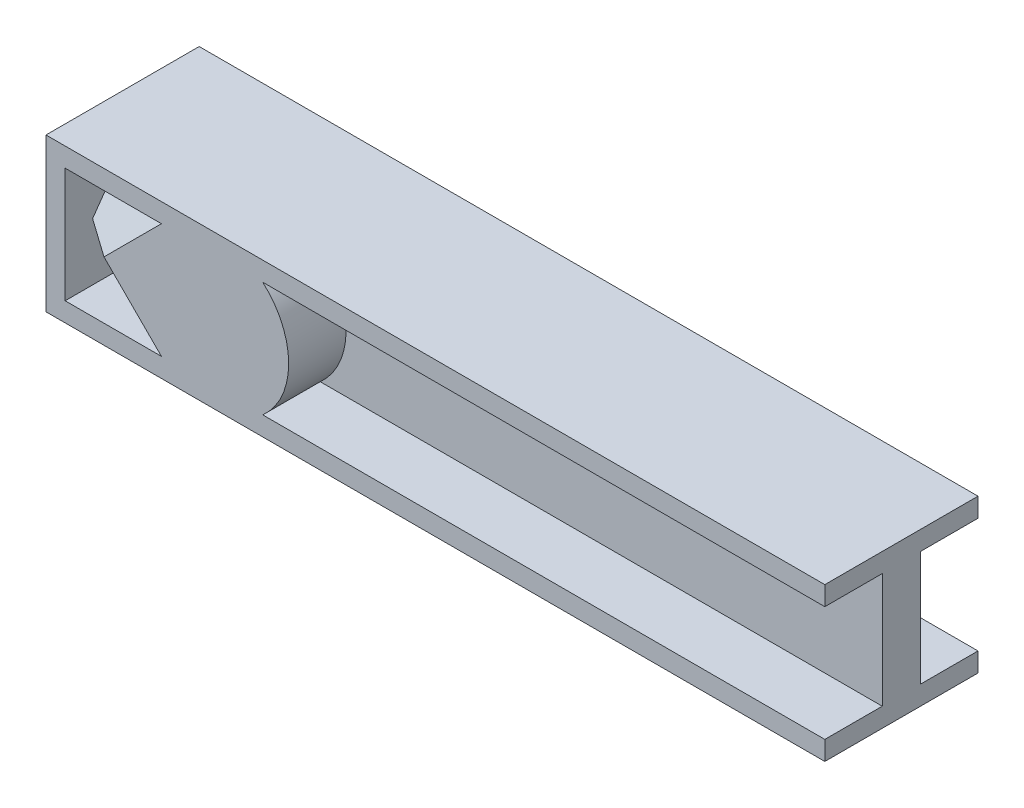
from build123d import *

# Parameters (mm, degrees)
SKETCH1_W           = 80
SKETCH1_H           = 20
BOSS_EXTRUDE1_DEPTH = 10
SKETCH2_W           = 80
SKETCH2_H           = 7.5
CUT_EXTRUDE1_DEPTH  = 7.5
BOSS_EXTRUDE2_DEPTH = 10
SKETCH4_W           = 25.799353936
SKETCH4_H           = 15
BOSS_EXTRUDE3_DEPTH = 2.5
CHAMFER1_SIZE       = 7.5


# Some blends are built 0.0001 mm under size
with BuildPart() as part:
    # Sketch1 → Boss-Extrude1 (new, symmetric)
    with BuildSketch(Plane(origin=(0, 0, 0), x_dir=(1, 0, 0), z_dir=(0, 1, 0))):
        Rectangle(SKETCH1_W, SKETCH1_H)
    extrude(amount=BOSS_EXTRUDE1_DEPTH, both=True)

    # Sketch2 → Cut-Extrude1 (cut, symmetric)
    with BuildSketch(Plane(origin=(0, 0, 0), x_dir=(1, 0, 0), z_dir=(0, 1, 0))):
        with Locations((0, 6.25)):
            Rectangle(SKETCH2_W, SKETCH2_H)
        with Locations((0, -6.25)):
            Rectangle(SKETCH2_W, SKETCH2_H)
    extrude(amount=CUT_EXTRUDE1_DEPTH, both=True, mode=Mode.SUBTRACT)

    # Sketch3 → Boss-Extrude2 (add, symmetric)
    with BuildSketch(Plane.XY):
        with BuildLine():
            Line((-40, 10), (-61.684975658, 10))
            Line((-61.684975658, 10), (-61.684975658, -10))
            Line((-61.684975658, -10), (-40, -10))
            ThreePointArc((-40, -10), (-30, 0), (-40, 10))
        make_face()
        Polygon((-46.614378278, 7.5), (-54.114378278, 0), (-46.614378278, -7.5), (-59.184975658, -7.5), (-59.184975658, 7.5), align=None, mode=Mode.SUBTRACT)
    extrude(amount=BOSS_EXTRUDE2_DEPTH, both=True)

    # Sketch4 → Boss-Extrude3 (add, symmetric)
    with BuildSketch(Plane.XY):
        with Locations((-46.28529869, 0)):
            Rectangle(SKETCH4_W, SKETCH4_H)
    extrude(amount=BOSS_EXTRUDE3_DEPTH, both=True)

    # Chamfer1
    # the kernel refuses this chamfer: 7.5 mm, written as the material it adds along each edge
    with BuildSketch(Plane(origin=(-54.114378278, 0, 2.5), x_dir=(0.019442520806014087, 0.019442520806013695, 0.9996219169112968), z_dir=(0.7071067811865405, -0.7071067811865547, 0))) as chamfer1_piece_1_section:
        with BuildLine():
            Line((7.715048964, 0), (-0.424103662, 7.703383451))
            Line((-0.424103662, 7.703383451), (-0.574046949, 7.69925907))
            ThreePointArc((-0.574046949, 7.69925907), (-0.255969203, 3.850483722), (-0.149943288, -0.004124381))
            Line((-0.149943288, -0.004124381), (0.004124381, -0.149943288))
            ThreePointArc((0.004124381, -0.149943288), (3.858732485, -0.043917372), (7.719173345, -0.149943288))
            Line((7.719173345, -0.149943288), (7.715048964, 0))
        make_face()
    chamfer1_piece_1 = extrude(amount=29.894224128, mode=Mode.PRIVATE)
    chamfer1_piece_1 = split(chamfer1_piece_1, bisect_by=Plane(origin=(-52.527454049, -4.471025257, 10), z_dir=(0, 0, -1)), keep=Keep.TOP, mode=Mode.PRIVATE)
    chamfer1_piece_1 = split(chamfer1_piece_1, bisect_by=Plane(origin=(-52.527454049, -7.5, 5.197194263), z_dir=(0, 1, 0)), keep=Keep.TOP, mode=Mode.PRIVATE)
    add(chamfer1_piece_1)
    chamfer1_2_edges = [part.edges().sort_by_distance(p)[0] for p in [
        (-52.899676968, 1.21470131, 2.5),
    ]]
    chamfer(chamfer1_2_edges, length=CHAMFER1_SIZE - 0.0001)  # a hair under: the kernel refuses the full size
    # the kernel refuses this chamfer: 7.5 mm, written as the material it adds along each edge
    with BuildSketch(Plane(origin=(-54.114378278, 0, -2.5), x_dir=(0.019442520806014087, 0.019442520806013695, -0.9996219169112968), z_dir=(0.7071067811865405, -0.7071067811865547, 0))) as chamfer1_3_piece_1_section:
        with BuildLine():
            Line((7.715048964, 0), (-0.424103662, -7.703383451))
            Line((-0.424103662, -7.703383451), (-0.574046949, -7.69925907))
            ThreePointArc((-0.574046949, -7.69925907), (-0.255969203, -3.850483722), (-0.149943288, 0.004124381))
            Line((-0.149943288, 0.004124381), (0.004124381, 0.149943288))
            ThreePointArc((0.004124381, 0.149943288), (3.858732485, 0.043917372), (7.719173345, 0.149943288))
            Line((7.719173345, 0.149943288), (7.715048964, 0))
        make_face()
    chamfer1_3_piece_1 = extrude(amount=29.894224128, mode=Mode.PRIVATE)
    chamfer1_3_piece_1 = split(chamfer1_3_piece_1, bisect_by=Plane(origin=(-52.527454049, -4.471025257, -10), z_dir=(0, 0, 1)), keep=Keep.TOP, mode=Mode.PRIVATE)
    chamfer1_3_piece_1 = split(chamfer1_3_piece_1, bisect_by=Plane(origin=(-52.527454049, -7.5, -5.197194263), z_dir=(0, 1, 0)), keep=Keep.TOP, mode=Mode.PRIVATE)
    add(chamfer1_3_piece_1)
    chamfer1_4_edges = [part.edges().sort_by_distance(p)[0] for p in [
        (-52.899676968, 1.21470131, -2.5),
    ]]
    chamfer(chamfer1_4_edges, length=CHAMFER1_SIZE - 0.0001)  # a hair under: the kernel refuses the full size


solid = part.part
